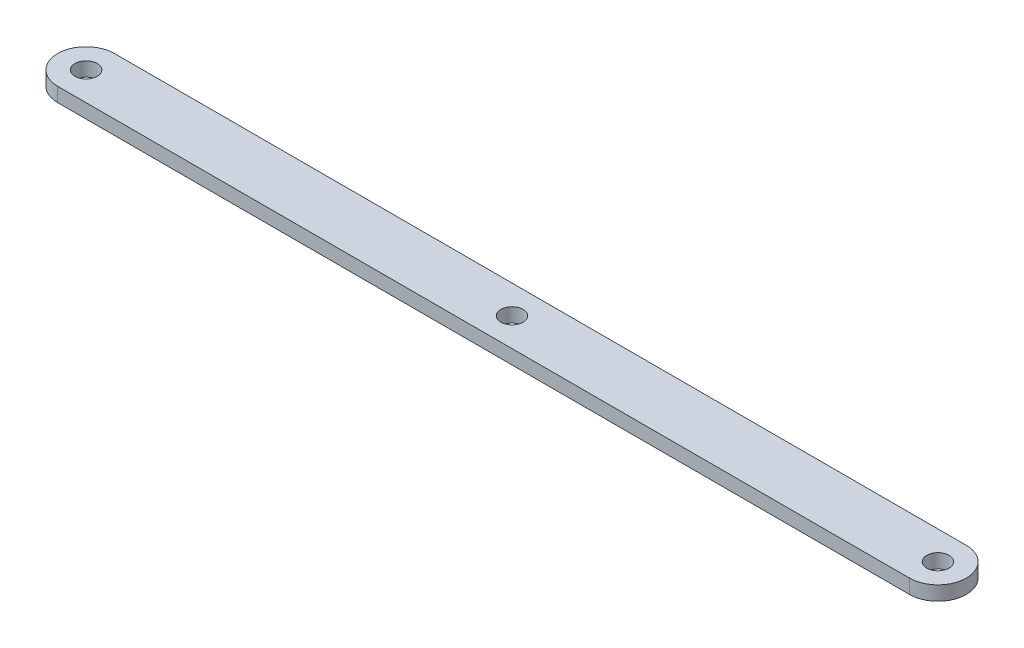
from build123d import *

# Parameters (mm, degrees)
BOSS_EXTRUDE1_DEPTH    = 3.175
F_10_CLEARANCE_HOLE1_D = 4.9784


with BuildPart() as part:
    # Sketch1 → Boss-Extrude1 (new body)
    with BuildSketch(Plane(origin=(0, 0, 0), x_dir=(1, 0, 0), z_dir=(0, 1, 0))):
        with BuildLine():
            Line((-95.25, 6.35), (95.25, 6.35))
            ThreePointArc((95.25, 6.35), (101.6, 0), (95.25, -6.35))
            Line((95.25, -6.35), (-95.25, -6.35))
            ThreePointArc((-95.25, -6.35), (-101.6, 0), (-95.25, 6.35))
        make_face()
    extrude(amount=BOSS_EXTRUDE1_DEPTH)

    # #10 Clearance Hole1 (through all)
    with Locations(Plane(origin=(0, 3.175, 0), x_dir=(1, 0, 0), z_dir=(0, 1, 0))):
        with Locations((-95.25, 0), (0, 0), (95.25, 0)):
            Hole(F_10_CLEARANCE_HOLE1_D / 2)


solid = part.part
